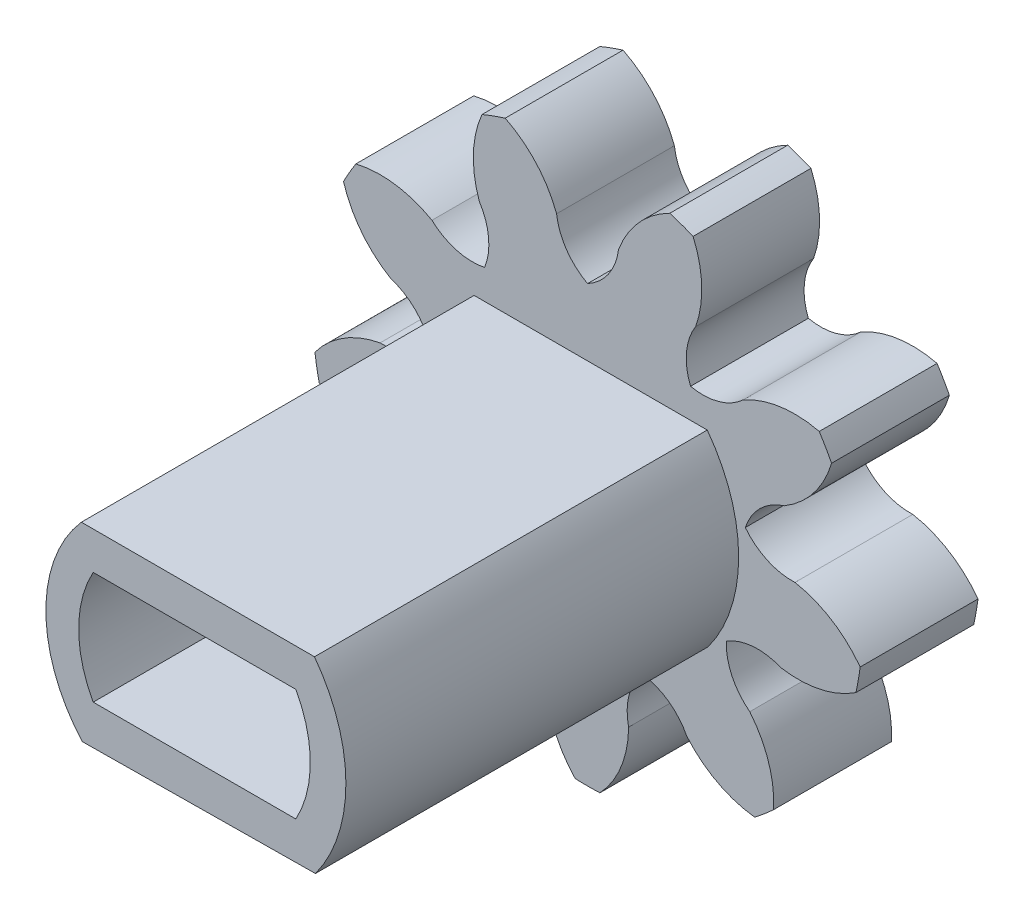
from build123d import *

# Parameters (mm, degrees)
SKETCH1_R           = 7
BOSS_EXTRUDE1_DEPTH = 3
CUT_EXTRUDE1_DEPTH  = 3
CIRPATTERN2_COUNT   = 9
BOSS_EXTRUDE3_DEPTH = 10


with BuildPart() as part:
    # Sketch1 → Boss-Extrude1 (new body)
    with BuildSketch(Plane.XY):
        Circle(SKETCH1_R)
    extrude(amount=BOSS_EXTRUDE1_DEPTH)

    # Sketch2 → Cut-Extrude1 (cut)
    with BuildSketch(Plane.XY):
        with BuildLine():
            ThreePointArc((0, 4.078835337), (-0.53352484, 4.555467925), (-0.788553769, 5.223889666))
            ThreePointArc((-0.788553769, 5.223889666), (-1.304034669, 6.075672879), (-2.096204347, 6.678766902))
            ThreePointArc((-2.096204347, 6.678766902), (0, 7.685460497), (2.096204347, 6.678766902))
            ThreePointArc((2.096204347, 6.678766902), (1.304034669, 6.075672879), (0.788553769, 5.223889666))
            ThreePointArc((0.788553769, 5.223889666), (0.53352484, 4.555467925), (0, 4.078835337))
        make_face()
    cut_extrude1 = extrude(amount=CUT_EXTRUDE1_DEPTH, mode=Mode.SUBTRACT)

    # CirPattern2: Cut-Extrude1 ×9 about axis
    cirpattern2_axis = Axis((0, 0, 3), (0, 0, -1))
    for i in range(1, CIRPATTERN2_COUNT):
        add(cut_extrude1.rotate(cirpattern2_axis, i * 360 / CIRPATTERN2_COUNT), mode=Mode.SUBTRACT)

    # Sketch3 → Boss-Extrude3 (add)
    with BuildSketch(Plane.XY.offset(3)):
        with BuildLine():
            Line((-2.88779545, 2.374210321), (3.047696411, 2.374210321))
            ThreePointArc((3.047696411, 2.374210321), (3.847312365, -0.005653558), (3.071689232, -2.393444695))
            Line((3.071689232, -2.393444695), (-2.863502002, -2.453182904))
            ThreePointArc((-2.863502002, -2.453182904), (-3.791753455, -0.044096512), (-2.88779545, 2.374210321))
        make_face()
        with BuildLine():
            Line((2.572547893, -1.440473418), (-2.586201141, -1.443565434))
            ThreePointArc((-2.586201141, -1.443565434), (-2.956933549, -0.012903533), (-2.587058708, 1.417980317))
            Line((-2.587058708, 1.417980317), (2.571691253, 1.417980317))
            ThreePointArc((2.571691253, 1.417980317), (2.941566094, -0.011135832), (2.572547893, -1.440473418))
        make_face(mode=Mode.SUBTRACT)
    extrude(amount=BOSS_EXTRUDE3_DEPTH)


solid = part.part
